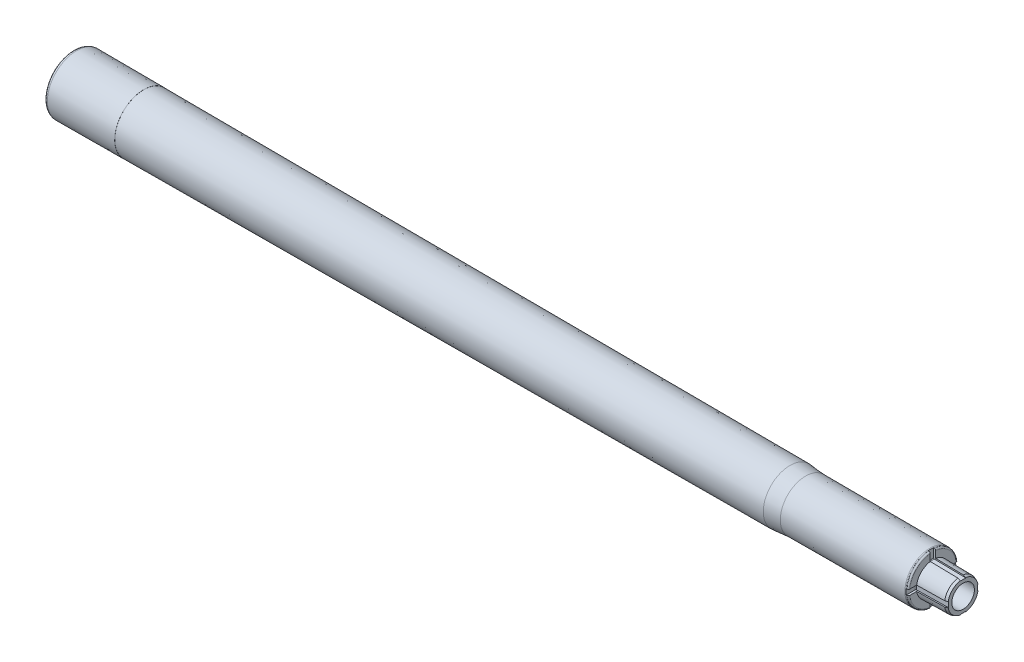
from build123d import *

# Parameters (mm, degrees)
CORTE_EXTRUS_O1_DEPTH = 0.4
FILETE4_R             = 0.1
PADR_OCIRCULAR1_COUNT = 4


with BuildPart() as part:
    # Sketch1 → Base-Revolve (revolve)
    with BuildSketch(Plane.XY):
        with BuildLine():
            Line((0, 1.65), (0, 2.213875))
            Line((0, 2.213875), (-0.374000364, 2.35))
            Line((-0.374000364, 2.35), (-4.4, 2.425))
            Line((-4.4, 2.425), (-4.4, 3.42))
            ThreePointArc((-4.4, 3.42), (-4.458578644, 3.561421356), (-4.6, 3.62))
            Line((-4.6, 3.62), (-4.7, 3.62))
            Line((-4.7, 3.62), (-4.7, 3.63))
            Line((-4.7, 3.63), (-4.851915082, 3.65))
            Line((-4.851915082, 3.65), (-23.0065, 3.7))
            Line((-23.0065, 3.7), (-25.292510461, 3.9))
            Line((-25.292510461, 3.9), (-119.7, 4.22875))
            Line((-119.7, 4.22875), (-119.7, 4.243675))
            Line((-119.7, 4.243675), (-129.50075, 4.28))
            Line((-129.50075, 4.28), (-129.50075, 4.273525))
            ThreePointArc((-129.50075, 4.273525), (-129.85433268, 4.12710768), (-130.00075, 3.773625))
            Line((-130.00075, 3.773625), (-130.00075, 3.50325919))
            Line((-130.00075, 3.50325919), (-128.03044729, 3.4))
            Line((-128.03044729, 3.4), (-127.70075, 3.28))
            Line((-127.70075, 3.28), (-119.70075, 3.25))
            Line((-119.70075, 3.25), (-119.70075, 3.034845938))
            ThreePointArc((-119.70075, 3.034845938), (-119.642225836, 2.893479083), (-119.500904121, 2.834845998))
            Line((-119.500904121, 2.834845998), (-27.27315, 2.76377482))
            Line((-27.27315, 2.76377482), (-22.99315, 2.49))
            Line((-22.99315, 2.49), (-5.94179023, 2.451356692))
            ThreePointArc((-5.94179023, 2.451356692), (-5.518405452, 2.275141277), (-5.34315, 1.851358233))
            Line((-5.34315, 1.851358233), (-5.34315, 1.65))
            Line((-5.34315, 1.65), (0, 1.65))
        make_face()
    revolve(axis=Axis((0, 0, 0), (-1, 0, 0)))

    # Esboço1 → Corte-extrusão1 (cut, symmetric)
    with BuildSketch(Plane.XY):
        with BuildLine():
            Line((0, 2.112992874), (-4.601862568, 2.198720575))
            ThreePointArc((-4.601862568, 2.198720575), (-4.671366157, 2.228654162), (-4.7, 2.298703227))
            Line((-4.7, 2.298703227), (-4.7, 4.112992874))
            Line((-4.7, 4.112992874), (0, 4.112992874))
            Line((0, 4.112992874), (0, 2.112992874))
        make_face()
        with BuildLine():
            Line((-4.7, -2.298703227), (-4.7, -4.112992874))
            Line((-4.7, -4.112992874), (0, -4.112992874))
            Line((0, -4.112992874), (0, -2.112992874))
            Line((0, -2.112992874), (-4.601862568, -2.198720575))
            ThreePointArc((-4.601862568, -2.198720575), (-4.671366157, -2.228654162), (-4.7, -2.298703227))
        make_face()
    corte_extrus_o1 = extrude(amount=CORTE_EXTRUS_O1_DEPTH, both=True, mode=Mode.SUBTRACT)

    # Filete4
    filete4_edges = [part.edges().sort_by_distance(p)[0] for p in [
        (-4.7, -2.948267954, -0.4),
        (-4.671366157, -2.228654162, -0.4),
        (-2.300931284, -2.155856724, -0.4),
    ]]
    fillet(filete4_edges, radius=FILETE4_R)
    filete4_2_edges = [part.edges().sort_by_distance(p)[0] for p in [
        (-4.7, 2.948267954, -0.4),
        (-4.671366157, 2.228654162, -0.4),
        (-2.300931284, 2.155856724, -0.4),
    ]]
    fillet(filete4_2_edges, radius=FILETE4_R)
    filete4_3_edges = [part.edges().sort_by_distance(p)[0] for p in [
        (-4.7, 2.948267954, 0.4),
        (-4.671366157, 2.228654162, 0.4),
        (-2.300931284, 2.155856724, 0.4),
    ]]
    fillet(filete4_3_edges, radius=FILETE4_R)
    filete4_4_edges = [part.edges().sort_by_distance(p)[0] for p in [
        (-4.7, -2.948267954, 0.4),
        (-4.671366157, -2.228654162, 0.4),
        (-2.300931284, -2.155856724, 0.4),
    ]]
    fillet(filete4_4_edges, radius=FILETE4_R)

    # PadrãoCircular1: Corte-extrusão1 ×4 about axis
    padr_ocircular1_axis = Axis((0, 0, 0), (1, 0, 0))
    for i in range(1, PADR_OCIRCULAR1_COUNT):
        add(corte_extrus_o1.rotate(padr_ocircular1_axis, i * 360 / PADR_OCIRCULAR1_COUNT), mode=Mode.SUBTRACT)


solid = part.part
